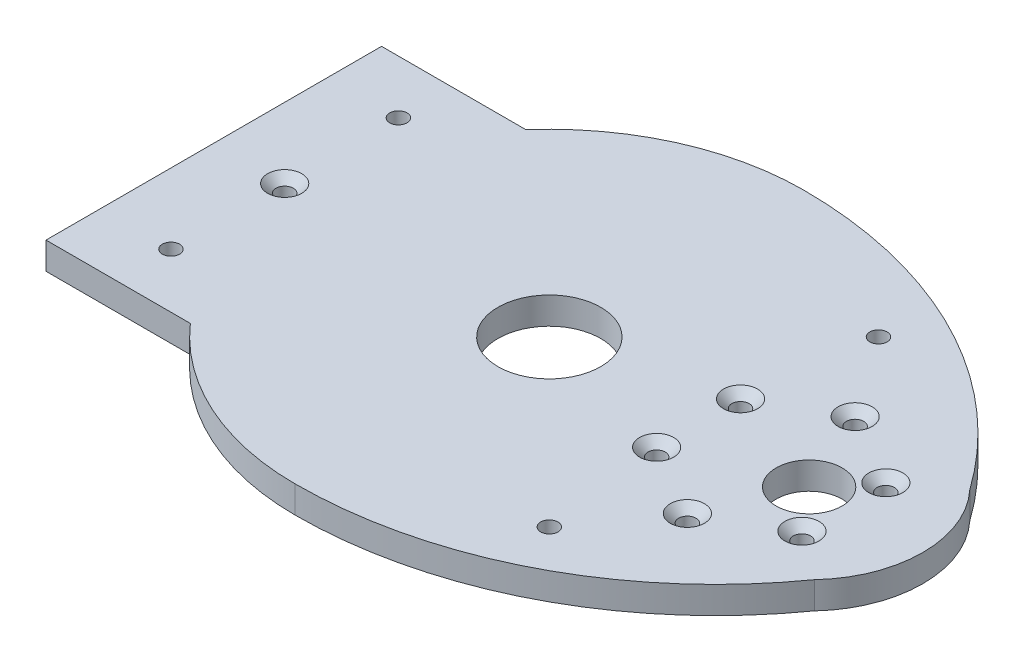
from build123d import *

# Parameters (mm, degrees)
SKETCH1_R                                           = 6.1
SKETCH1_R_2                                         = 9.5
BOSS_EXTRUDE1_DEPTH                                 = 5
CSK_FOR_M3_COUNTERSUNK_FLAT_HEAD_SCREW1_D           = 3.2
CSK_FOR_M3_COUNTERSUNK_FLAT_HEAD_SCREW1_DEPTH       = 9.5
CSK_FOR_M3_COUNTERSUNK_FLAT_HEAD_SCREW1_CSINK_D     = 6.3
CSK_FOR_M3_COUNTERSUNK_FLAT_HEAD_SCREW1_CSINK_ANGLE = 90
CSK_FOR_M3_COUNTERSUNK_FLAT_HEAD_SCREW1_TIP         = 0.96137699
CSK_FOR_M3_COUNTERSUNK_FLAT_HEAD_SCREW2_D           = 3.2
CSK_FOR_M3_COUNTERSUNK_FLAT_HEAD_SCREW2_CSINK_D     = 6.3
CSK_FOR_M3_COUNTERSUNK_FLAT_HEAD_SCREW2_CSINK_ANGLE = 90
SKETCH6_R                                           = 1.6
CUT_EXTRUDE2_DEPTH                                  = 84.6361166
CSK_FOR_M3_COUNTERSUNK_FLAT_HEAD_SCREW3_D           = 3.2
CSK_FOR_M3_COUNTERSUNK_FLAT_HEAD_SCREW3_CSINK_D     = 6.3
CSK_FOR_M3_COUNTERSUNK_FLAT_HEAD_SCREW3_CSINK_ANGLE = 90


with BuildPart() as part:
    # Sketch1 → Boss-Extrude1 (new body)
    with BuildSketch(Plane(origin=(0, 0, 0), x_dir=(1, 0, 0), z_dir=(0, 1, 0))):
        with BuildLine():
            Line((-35.327043465, 31), (-62, 31))
            Line((-62, 31), (-62, -31))
            Line((-62, -31), (-35.327043465, -31))
            ThreePointArc((-35.327043465, -31), (-19.39071943, -42.813549257), (0, -47))
            ThreePointArc((0, -47), (35.614793301, -38.36216221), (63.315219873, -14.368160642))
            ThreePointArc((63.315219873, -14.368160642), (69, 0), (63.315219873, 14.368160642))
            ThreePointArc((63.315219873, 14.368160642), (35.614793301, 38.36216221), (0, 47))
            ThreePointArc((0, 47), (-19.39071943, 42.813549257), (-35.327043465, 31))
        make_face()
        with Locations((48, 0)):
            Circle(SKETCH1_R, mode=Mode.SUBTRACT)
        Circle(SKETCH1_R_2, mode=Mode.SUBTRACT)
    extrude(amount=BOSS_EXTRUDE1_DEPTH)

    # CSK for M3 Countersunk Flat Head Screw1
    with Locations(Plane(origin=(0, 5, 0), x_dir=(1, 0, 0), z_dir=(0, 1, 0))):
        with Locations((27.576606241, 7.75), (41, 15.5), (27.576606241, -7.75), (41, -15.5), (54.423393759, -7.75), (54.423393759, 7.75)):
            CounterSinkHole(CSK_FOR_M3_COUNTERSUNK_FLAT_HEAD_SCREW1_D / 2, CSK_FOR_M3_COUNTERSUNK_FLAT_HEAD_SCREW1_CSINK_D / 2, depth=CSK_FOR_M3_COUNTERSUNK_FLAT_HEAD_SCREW1_DEPTH, counter_sink_angle=CSK_FOR_M3_COUNTERSUNK_FLAT_HEAD_SCREW1_CSINK_ANGLE)
            with Locations((0, 0, -(CSK_FOR_M3_COUNTERSUNK_FLAT_HEAD_SCREW1_DEPTH + CSK_FOR_M3_COUNTERSUNK_FLAT_HEAD_SCREW1_TIP / 2))):  # 118° drill point
                Cone(0, CSK_FOR_M3_COUNTERSUNK_FLAT_HEAD_SCREW1_D / 2, CSK_FOR_M3_COUNTERSUNK_FLAT_HEAD_SCREW1_TIP, mode=Mode.SUBTRACT)

    # CSK for M3 Countersunk Flat Head Screw2 (through all)
    with Locations(Plane(origin=(0, 0, 0), x_dir=(-1, 0, 0), z_dir=(0, -1, 0))):
        with Locations((-30.405591591, -30.405591591), (-30.405591591, 30.405591591)):
            CounterSinkHole(CSK_FOR_M3_COUNTERSUNK_FLAT_HEAD_SCREW2_D / 2, CSK_FOR_M3_COUNTERSUNK_FLAT_HEAD_SCREW2_CSINK_D / 2, counter_sink_angle=CSK_FOR_M3_COUNTERSUNK_FLAT_HEAD_SCREW2_CSINK_ANGLE)

    # Sketch6 → Cut-Extrude2 (cut, through all)
    with BuildSketch(Plane.XZ):
        with Locations((-49, -21.11)):
            Circle(SKETCH6_R)
        with Locations((-49, 20.91)):
            Circle(SKETCH6_R)
        with Locations((-49, -0.1)):
            Circle(SKETCH6_R)
    extrude(amount=-CUT_EXTRUDE2_DEPTH, mode=Mode.SUBTRACT)

    # CSK for M3 Countersunk Flat Head Screw3 (through all)
    with Locations(Plane(origin=(0, 5, 0), x_dir=(1, 0, 0), z_dir=(0, 1, 0))):
        with Locations((-49, 0.1)):
            CounterSinkHole(CSK_FOR_M3_COUNTERSUNK_FLAT_HEAD_SCREW3_D / 2, CSK_FOR_M3_COUNTERSUNK_FLAT_HEAD_SCREW3_CSINK_D / 2, counter_sink_angle=CSK_FOR_M3_COUNTERSUNK_FLAT_HEAD_SCREW3_CSINK_ANGLE)


solid = part.part
